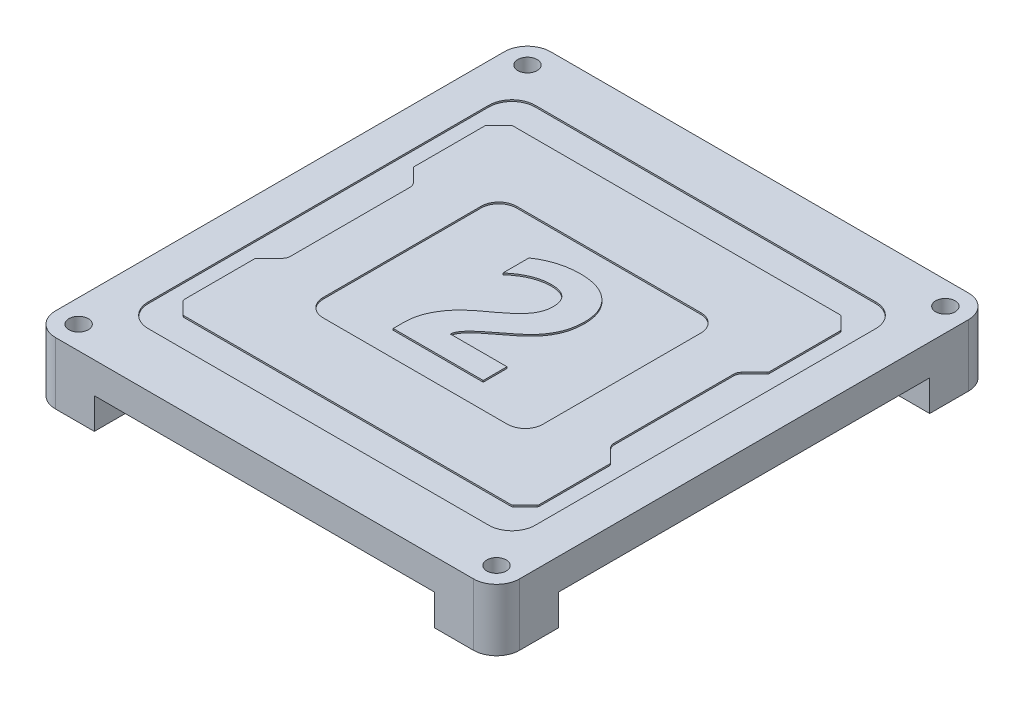
from build123d import *

# Parameters (mm, degrees)
EXTRUDE_1_DEPTH     = 4
EXTRUDE_START       = 4
EXTRUDE_2_DEPTH     = 4
SKETCH_3_R          = 1.25
CUT_EXTRUDE_1_DEPTH = 15
CUT_EXTRUDE_2_DEPTH = 0.2
EXTRUDE_5_DEPTH     = 0.2
EXTRUDE_6_DEPTH     = 0.2
SKETCH_13_R         = 2.280555424
SKETCH_13_R_2       = 2.93479419
SKETCH_13_R_3       = 2.630805897
SKETCH_13_R_4       = 2.84821008
EXTRUDE_7_DEPTH     = 0.2


with BuildPart() as part:
    # 草图1 → 凸台-拉伸1 (new body)
    with BuildSketch(Plane(origin=(0, 0, 0), x_dir=(1, 0, 0), z_dir=(0, 1, 0))):
        with BuildLine():
            Line((-27.00005461, -31.987363475), (27.00005461, -31.987363475))
            ThreePointArc((27.00005461, -31.987363475), (29.112398272, -31.112402082), (29.987359665, -29.00005842))
            Line((29.987359665, -29.00005842), (29.987359665, 29.00005842))
            ThreePointArc((29.987359665, 29.00005842), (29.112398272, 31.112402082), (27.00005461, 31.987363475))
            Line((27.00005461, 31.987363475), (-27.00005461, 31.987363475))
            ThreePointArc((-27.00005461, 31.987363475), (-29.112398272, 31.112402082), (-29.987359665, 29.00005842))
            Line((-29.987359665, 29.00005842), (-29.987359665, -29.00005842))
            ThreePointArc((-29.987359665, -29.00005842), (-29.112398272, -31.112402082), (-27.00005461, -31.987363475))
        make_face()
    extrude(amount=EXTRUDE_1_DEPTH)

    # 草图2 → 凸台-拉伸2 (add)
    with BuildSketch(Plane.XZ.offset(EXTRUDE_START)):
        with BuildLine():
            Line((-21.987359665, 23.987363475), (-21.987359665, 31.987363475))
            Line((-21.987359665, 31.987363475), (-27.00005461, 31.987363475))
            ThreePointArc((-27.00005461, 31.987363475), (-29.112398272, 31.112402082), (-29.987359665, 29.00005842))
            Line((-29.987359665, 29.00005842), (-29.987359665, 23.987363475))
            Line((-29.987359665, 23.987363475), (-21.987359665, 23.987363475))
        make_face()
        with BuildLine():
            Line((21.987359665, -23.987363475), (21.987359665, -31.987363475))
            Line((21.987359665, -31.987363475), (27.00005461, -31.987363475))
            ThreePointArc((27.00005461, -31.987363475), (29.112398272, -31.112402082), (29.987359665, -29.00005842))
            Line((29.987359665, -29.00005842), (29.987359665, -23.987363475))
            Line((29.987359665, -23.987363475), (21.987359665, -23.987363475))
        make_face()
        with BuildLine():
            Line((21.987359665, 23.987363475), (29.987359665, 23.987363475))
            Line((29.987359665, 23.987363475), (29.987359665, 29.00005842))
            ThreePointArc((29.987359665, 29.00005842), (29.112398272, 31.112402082), (27.00005461, 31.987363475))
            Line((27.00005461, 31.987363475), (21.987359665, 31.987363475))
            Line((21.987359665, 31.987363475), (21.987359665, 23.987363475))
        make_face()
        with BuildLine():
            Line((-29.987359665, -23.987363475), (-29.987359665, -29.00005842))
            ThreePointArc((-29.987359665, -29.00005842), (-29.112398272, -31.112402082), (-27.00005461, -31.987363475))
            Line((-27.00005461, -31.987363475), (-21.987359665, -31.987363475))
            Line((-21.987359665, -31.987363475), (-21.987359665, -23.987363475))
            Line((-21.987359665, -23.987363475), (-29.987359665, -23.987363475))
        make_face()
    extrude(amount=-EXTRUDE_2_DEPTH)

    # 草图3 → 切除-拉伸1 (cut)
    with BuildSketch(Plane.XZ.offset(4)):
        with Locations((-27.00005461, 29.00005842)):
            Circle(SKETCH_3_R)
        with Locations((27.00005461, 29.00005842)):
            Circle(SKETCH_3_R)
        with Locations((27.00005461, -29.00005842)):
            Circle(SKETCH_3_R)
        with Locations((-27.00005461, -29.00005842)):
            Circle(SKETCH_3_R)
    extrude(amount=-CUT_EXTRUDE_1_DEPTH, mode=Mode.SUBTRACT)

    # 草图4 → 切除-拉伸2 (cut)
    with BuildSketch(Plane(origin=(0, 4, 0), x_dir=(1, 0, 0), z_dir=(0, 1, 0))):
        with BuildLine():
            Line((-22, -25), (22, -25))
            ThreePointArc((22, -25), (24.121320344, -24.121320344), (25, -22))
            Line((25, -22), (25, 22))
            ThreePointArc((25, 22), (24.121320344, 24.121320344), (22, 25))
            Line((22, 25), (-22, 25))
            ThreePointArc((-22, 25), (-24.121320344, 24.121320344), (-25, 22))
            Line((-25, 22), (-25, -22))
            ThreePointArc((-25, -22), (-24.121320344, -24.121320344), (-22, -25))
        make_face()
    extrude(amount=-CUT_EXTRUDE_2_DEPTH, mode=Mode.SUBTRACT)

    # 草图9 → 凸台-拉伸5 (add)
    with BuildSketch(Plane(origin=(0, 3.8, 0), x_dir=(1, 0, 0), z_dir=(0, 1, 0))):
        with BuildLine():
            ThreePointArc((-21.208751083, 8.458751083), (-20.987642877, 8.127839267), (-20.91, 7.737502166))
            Line((-20.91, 7.737502166), (-20.91, -7.737502166))
            ThreePointArc((-20.91, -7.737502166), (-20.987642877, -8.127839267), (-21.208751083, -8.458751083))
            Line((-21.208751083, -8.458751083), (-22.850416306, -10.100416306))
            ThreePointArc((-22.850416306, -10.100416306), (-22.924119041, -10.210720244), (-22.95, -10.340832611))
            Line((-22.95, -10.340832611), (-22.95, -19.409167389))
            ThreePointArc((-22.95, -19.409167389), (-22.924119041, -19.539279756), (-22.850416306, -19.649583694))
            Line((-22.850416306, -19.649583694), (-21.349583694, -21.150416306))
            ThreePointArc((-21.349583694, -21.150416306), (-21.239279756, -21.224119041), (-21.109167389, -21.25))
            Line((-21.109167389, -21.25), (21.109167389, -21.25))
            ThreePointArc((21.109167389, -21.25), (21.239279756, -21.224119041), (21.349583694, -21.150416306))
            Line((21.349583694, -21.150416306), (22.850416306, -19.649583694))
            ThreePointArc((22.850416306, -19.649583694), (22.924119041, -19.539279756), (22.95, -19.409167389))
            Line((22.95, -19.409167389), (22.95, -10.340832611))
            ThreePointArc((22.95, -10.340832611), (22.924119041, -10.210720244), (22.850416306, -10.100416306))
            Line((22.850416306, -10.100416306), (21.208751083, -8.458751083))
            ThreePointArc((21.208751083, -8.458751083), (20.987642877, -8.127839267), (20.91, -7.737502166))
            Line((20.91, -7.737502166), (20.91, 7.737502166))
            ThreePointArc((20.91, 7.737502166), (20.987642877, 8.127839267), (21.208751083, 8.458751083))
            Line((21.208751083, 8.458751083), (22.850416306, 10.100416306))
            ThreePointArc((22.850416306, 10.100416306), (22.924119041, 10.210720244), (22.95, 10.340832611))
            Line((22.95, 10.340832611), (22.95, 19.409167389))
            ThreePointArc((22.95, 19.409167389), (22.924119041, 19.539279756), (22.850416306, 19.649583694))
            Line((22.850416306, 19.649583694), (21.349583694, 21.150416306))
            ThreePointArc((21.349583694, 21.150416306), (21.239279756, 21.224119041), (21.109167389, 21.25))
            Line((21.109167389, 21.25), (-21.109167389, 21.25))
            ThreePointArc((-21.109167389, 21.25), (-21.239279756, 21.224119041), (-21.349583694, 21.150416306))
            Line((-21.349583694, 21.150416306), (-22.850416306, 19.649583694))
            ThreePointArc((-22.850416306, 19.649583694), (-22.924119041, 19.539279756), (-22.95, 19.409167389))
            Line((-22.95, 19.409167389), (-22.95, 10.340832611))
            ThreePointArc((-22.95, 10.340832611), (-22.924119041, 10.210720244), (-22.850416306, 10.100416306))
            Line((-22.850416306, 10.100416306), (-21.208751083, 8.458751083))
        make_face()
        with BuildLine():
            ThreePointArc((-14.688, -17.765), (-16.15, -19.227), (-17.612, -17.765))
            ThreePointArc((-17.612, -17.765), (-16.15, -16.303), (-14.688, -17.765))
        make_face(mode=Mode.SUBTRACT)
        with BuildLine():
            ThreePointArc((14.688, -17.765), (16.15, -16.303), (17.612, -17.765))
            ThreePointArc((17.612, -17.765), (16.15, -19.227), (14.688, -17.765))
        make_face(mode=Mode.SUBTRACT)
        with BuildLine():
            Line((11.9, -12.495), (-11.9, -12.495))
            ThreePointArc((-11.9, -12.495), (-13.522810063, -11.822810063), (-14.195, -10.2))
            Line((-14.195, -10.2), (-14.195, 10.2))
            ThreePointArc((-14.195, 10.2), (-13.522810063, 11.822810063), (-11.9, 12.495))
            Line((-11.9, 12.495), (11.9, 12.495))
            ThreePointArc((11.9, 12.495), (13.522810063, 11.822810063), (14.195, 10.2))
            Line((14.195, 10.2), (14.195, -10.2))
            ThreePointArc((14.195, -10.2), (13.522810063, -11.822810063), (11.9, -12.495))
        make_face(mode=Mode.SUBTRACT)
        with BuildLine():
            ThreePointArc((-14.688, 17.765), (-16.15, 16.303), (-17.612, 17.765))
            ThreePointArc((-17.612, 17.765), (-16.15, 19.227), (-14.688, 17.765))
        make_face(mode=Mode.SUBTRACT)
        with BuildLine():
            ThreePointArc((17.612, 17.765), (16.15, 16.303), (14.688, 17.765))
            ThreePointArc((14.688, 17.765), (16.15, 19.227), (17.612, 17.765))
        make_face(mode=Mode.SUBTRACT)
    extrude(amount=EXTRUDE_5_DEPTH)

    # 草图12 → 凸台-拉伸6 (add)
    with BuildSketch(Plane(origin=(0, 3.8, 0), x_dir=(1, 0, 0), z_dir=(0, 1, 0))):
        with BuildLine():
            Line((-1.880505514, -6.082965813), (5.435424364, -6.082965813))
            Line((5.435424364, -6.082965813), (5.435424364, -9.156136544))
            Line((5.435424364, -9.156136544), (-6.198721978, -9.156136544))
            Line((-6.198721978, -9.156136544), (-6.198721978, -7.825343861))
            add(Edge.make_bspline(
                [(-6.198721978, -7.825343861), (-6.193769629, -7.596261622), (-6.184062873, -7.147253436), (-6.078726988, -6.49038156), (-5.920426703, -5.862733074), (-5.690469663, -5.265070016), (-5.401792769, -4.696325285), (-5.073175459, -4.143353688), (-4.688680644, -3.614957786), (-4.330811826, -3.186953198), (-4.009999749, -2.846789929), (-3.732585517, -2.583143853), (-3.428376806, -2.305095486), (-3.091442143, -2.017648246), (-2.724054221, -1.718049337), (-2.322783878, -1.41210878), (-1.893597509, -1.090492929), (-1.592971249, -0.879047614), (-1.438051246, -0.770084715)],
                knots=[0, 0, 0, 0, 1.235463945, 2.421547066, 3.581528553, 4.724177644, 5.869489868, 7.020953534, 8.192434176, 9.392640776, 10.02996671, 10.715178343, 11.457812761, 12.254335723, 13.105362497, 14.016280847, 14.97774141, 16, 16, 16, 16], degree=3))
            add(Edge.make_bspline(
                [(-1.438051246, -0.770084715), (-1.297851099, -0.665825952), (-1.025102567, -0.462998599), (-0.640391095, -0.152834387), (-0.279442842, 0.139511583), (0.039511006, 0.431954346), (0.33121705, 0.708808544), (0.584500597, 0.980853495), (0.808312377, 1.241252273), (1.062679007, 1.569470933), (1.317969163, 1.987910272), (1.540766355, 2.509420947), (1.677536982, 3.049571248), (1.694973343, 3.415886228), (1.703717047, 3.599579919)],
                knots=[0, 0, 0, 0, 1.124221039, 2.187085011, 3.179985414, 4.1124088, 4.970962739, 5.767369762, 6.503150781, 7.18007546, 8.438112042, 9.644755015, 10.818929971, 12, 12, 12, 12], degree=3))
            add(Edge.make_bspline(
                [(1.703717047, 3.599579919), (1.701868186, 3.69570698), (1.698270384, 3.882766057), (1.666759951, 4.154673401), (1.6165747, 4.40871139), (1.543894124, 4.644225363), (1.452218032, 4.861208761), (1.338157321, 5.057396528), (1.205409151, 5.236437168), (1.051609141, 5.397281921), (0.875185261, 5.539123676), (0.677093095, 5.659055432), (0.461346759, 5.762135255), (0.224186734, 5.844766471), (-0.033102091, 5.908805931), (-0.310390848, 5.957037337), (-0.60863692, 5.983911976), (-0.813760859, 5.988055867), (-0.920139661, 5.990204919)],
                knots=[0, 0, 0, 0, 1.133448933, 2.205642312, 3.223814888, 4.18351512, 5.107792621, 5.995951473, 6.85359169, 7.731039516, 8.613447048, 9.515420728, 10.456369029, 11.428774843, 12.472086912, 13.580554081, 14.745257334, 16, 16, 16, 16], degree=3))
            add(Edge.make_bspline(
                [(-0.920139661, 5.990204919), (-1.111445747, 5.985563833), (-1.493879896, 5.97628598), (-2.062134294, 5.881120847), (-2.625189836, 5.737510845), (-3.181465351, 5.534526203), (-3.730282389, 5.270395894), (-4.2711097, 4.950588308), (-4.808233403, 4.574946647), (-5.146922677, 4.286200194), (-5.320673197, 4.138070773)],
                knots=[0, 0, 0, 0, 0.939522063, 1.878169839, 2.824056393, 3.792900055, 4.78321315, 5.81347213, 6.878292338, 8, 8, 8, 8], degree=3))
            Line((-5.320673197, 4.138070773), (-5.320673197, 7.509640895))
            add(Edge.make_bspline(
                [(-5.320673197, 7.509640895), (-5.129283497, 7.633877546), (-4.749062837, 7.880689895), (-4.149230839, 8.195239006), (-3.533856553, 8.4638425), (-2.901482614, 8.685263807), (-2.250140291, 8.851322801), (-1.582680957, 8.977124786), (-0.896594287, 9.049416731), (-0.433259538, 9.058699612), (-0.19986527, 9.063375651)],
                knots=[0, 0, 0, 0, 1.007429259, 2.001389931, 2.987429445, 3.971229237, 4.957229955, 5.953650675, 6.969198396, 8, 8, 8, 8], degree=3))
            add(Edge.make_bspline(
                [(-0.19986527, 9.063375651), (0.011838657, 9.059989161), (0.424874049, 9.053382102), (1.026670765, 8.98560243), (1.595357225, 8.882045128), (2.128692138, 8.729802707), (2.629836011, 8.539128538), (3.094764451, 8.299336545), (3.530240028, 8.023481663), (3.922967887, 7.697843236), (4.282655976, 7.344374158), (4.589516901, 6.948062373), (4.850580659, 6.520833677), (5.068924447, 6.063256434), (5.23372253, 5.571135979), (5.347916852, 5.047740253), (5.422919875, 4.492358185), (5.431183687, 4.110885892), (5.435424364, 3.9151287)],
                knots=[0, 0, 0, 0, 1.175700782, 2.29379795, 3.360181687, 4.383610167, 5.370921772, 6.333926658, 7.28536179, 8.228791148, 9.16300247, 10.081644873, 11.005433281, 11.94020586, 12.892298038, 13.881630337, 14.912932592, 16, 16, 16, 16], degree=3))
            add(Edge.make_bspline(
                [(5.435424364, 3.9151287), (5.4305495, 3.696458444), (5.421018648, 3.268936021), (5.334894528, 2.644760515), (5.204504524, 2.050565389), (5.009467555, 1.488523184), (4.762767796, 0.952763178), (4.468921104, 0.436148188), (4.129066727, -0.066523004), (3.80144565, -0.469914669), (3.506704257, -0.792728856), (3.250897723, -1.046060662), (2.967172196, -1.313734532), (2.649829363, -1.590918595), (2.304379286, -1.88263794), (1.925187993, -2.184881526), (1.51542663, -2.498822842), (1.229594926, -2.70956914), (1.08290912, -2.81772191)],
                knots=[0, 0, 0, 0, 1.251525673, 2.446859026, 3.60148383, 4.729825321, 5.845964658, 6.974685934, 8.129533438, 9.31659125, 9.946781861, 10.631911092, 11.377579922, 12.18005771, 13.044278351, 13.966510779, 14.956434852, 16, 16, 16, 16], degree=3))
            add(Edge.make_bspline(
                [(1.08290912, -2.81772191), (0.942009112, -2.923685022), (0.671522, -3.127103436), (0.285834558, -3.426244413), (-0.062652345, -3.706698309), (-0.377918136, -3.967484978), (-0.652584402, -4.213494094), (-0.89537688, -4.437168718), (-1.102151856, -4.641377999), (-1.318971681, -4.88555328), (-1.534944931, -5.165721404), (-1.730325671, -5.487546589), (-1.853782015, -5.790783667), (-1.872059002, -5.990615624), (-1.880505514, -6.082965813)],
                knots=[0, 0, 0, 0, 1.404320321, 2.695887337, 3.887765454, 4.967519503, 5.954491951, 6.824443279, 7.597203516, 8.268042687, 9.424676016, 10.408660756, 11.264579691, 12, 12, 12, 12], degree=3))
        make_face()
    extrude(amount=EXTRUDE_6_DEPTH)

    # 草图13 → 凸台-拉伸7 (add)
    with BuildSketch(Plane(origin=(0, 3.8, 0), x_dir=(1, 0, 0), z_dir=(0, 1, 0))):
        with Locations((-16.15, 17.765)):
            Circle(SKETCH_13_R)
        with Locations((16.15, 17.765)):
            Circle(SKETCH_13_R_2)
        with Locations((16.15, -17.765)):
            Circle(SKETCH_13_R_3)
        with Locations((-16.15, -17.765)):
            Circle(SKETCH_13_R_4)
    extrude(amount=EXTRUDE_7_DEPTH)


solid = part.part
